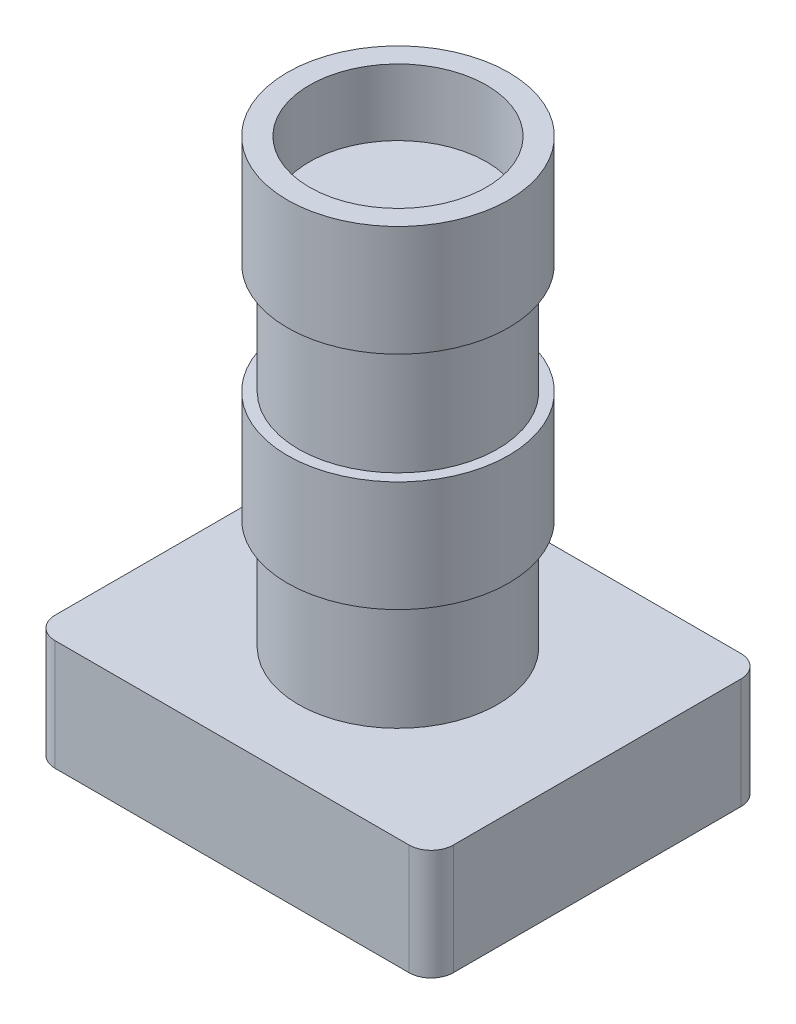
from build123d import *

# Parameters (mm, degrees)
BOSS_EXTRUDE1_DEPTH = 5
SKETCH1_5_R         = 4
CUT_EXTRUDE2_DEPTH  = 13.737739203
SKETCH1_6_R         = 4
BOSS_EXTRUDE4_DEPTH = 10
SKETCH3_R           = 5
BOSS_EXTRUDE5_DEPTH = 5
SKETCH4_R           = 4.5
BOSS_EXTRUDE6_DEPTH = 5
SKETCH5_R           = 5
BOSS_EXTRUDE7_DEPTH = 5
CUT_EXTRUDE3_START  = -3
SKETCH8_R           = 4
CUT_EXTRUDE3_DEPTH  = 3


with BuildPart() as part:
    # Sketch1 → Boss-Extrude1 (new body)
    with BuildSketch(Plane(origin=(0, 0, 0), x_dir=(1, 0, 0), z_dir=(0, 1, 0))):
        with BuildLine():
            Line((8, 7.5), (-8, 7.5))
            ThreePointArc((-8, 7.5), (-8.707106781, 7.207106781), (-9, 6.5))
            Line((-9, 6.5), (-9, -6.5))
            ThreePointArc((-9, -6.5), (-8.707106781, -7.207106781), (-8, -7.5))
            Line((-8, -7.5), (8, -7.5))
            ThreePointArc((8, -7.5), (8.707106781, -7.207106781), (9, -6.5))
            Line((9, -6.5), (9, 6.5))
            ThreePointArc((9, 6.5), (8.707106781, 7.207106781), (8, 7.5))
        make_face()
    extrude(amount=BOSS_EXTRUDE1_DEPTH)

    # Sketch1<5> → Cut-Extrude2 (cut, through all)
    with BuildSketch(Plane(origin=(0, 0, 0), x_dir=(1, 0, 0), z_dir=(0, 1, 0))):
        Circle(SKETCH1_5_R)
    extrude(amount=CUT_EXTRUDE2_DEPTH, mode=Mode.SUBTRACT)

    # Sketch1<6> → Boss-Extrude4 (add)
    with BuildSketch(Plane(origin=(0, 0, 0), x_dir=(1, 0, 0), z_dir=(0, 1, 0))):
        with BuildLine():
            ThreePointArc((-4.5, 4e-09), (-2e-09, -4.5), (4.5, 0))
            ThreePointArc((4.5, 0), (2e-09, 4.5), (-4.5, 4e-09))
        make_face()
        Circle(SKETCH1_6_R, mode=Mode.SUBTRACT)
    extrude(amount=BOSS_EXTRUDE4_DEPTH)

    # Sketch3 → Boss-Extrude5 (add)
    with BuildSketch(Plane(origin=(0, 10, 0), x_dir=(1, 0, 0), z_dir=(0, 1, 0))):
        Circle(SKETCH3_R)
    extrude(amount=BOSS_EXTRUDE5_DEPTH)

    # Sketch4 → Boss-Extrude6 (add)
    with BuildSketch(Plane(origin=(0, 15, 0), x_dir=(1, 0, 0), z_dir=(0, 1, 0))):
        Circle(SKETCH4_R)
    extrude(amount=BOSS_EXTRUDE6_DEPTH)

    # Sketch5 → Boss-Extrude7 (add)
    with BuildSketch(Plane(origin=(0, 20, 0), x_dir=(1, 0, 0), z_dir=(0, 1, 0))):
        Circle(SKETCH5_R)
    extrude(amount=BOSS_EXTRUDE7_DEPTH)

    # Sketch8 → Cut-Extrude3 (cut)
    with BuildSketch(Plane(origin=(0, 25, 0), x_dir=(1, 0, 0), z_dir=(0, 1, 0)).offset(CUT_EXTRUDE3_START)):
        Circle(SKETCH8_R)
    extrude(amount=CUT_EXTRUDE3_DEPTH, mode=Mode.SUBTRACT)


solid = part.part
